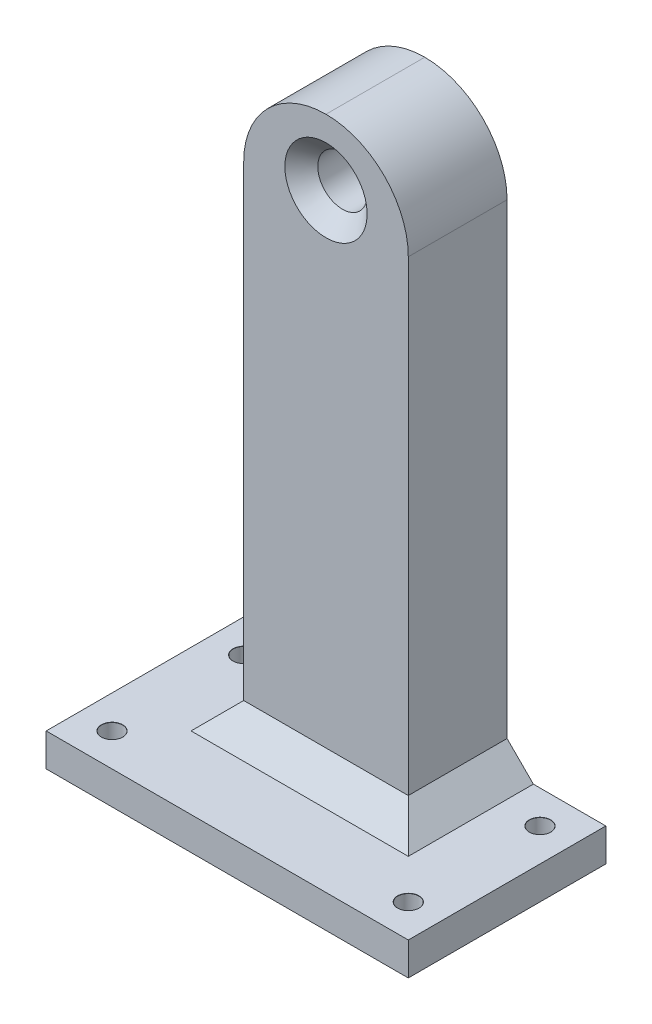
from build123d import *

# Parameters (mm, degrees)
SKETCH1_R                            = 3.75
BOSS_EXTRUDE1_DEPTH                  = 15
SKETCH2_W                            = 55
SKETCH2_H                            = 5
BOSS_EXTRUDE2_DEPTH                  = 30
F_3_2_3_2_DIAMETER_HOLE1_D           = 3.2
F_3_2_3_2_DIAMETER_HOLE1_CSINK_D     = 3.25
F_3_2_3_2_DIAMETER_HOLE1_CSINK_ANGLE = 90
CHAMFER1_SIZE                        = 4
FILLET2_R                            = 12.5
CHAMFER2_SIZE                        = 2.5


with BuildPart() as part:
    # Sketch1 → Boss-Extrude1 (new body)
    with BuildSketch(Plane.XY):
        Polygon((0, 0), (-12.5, 0), (-12.5, 92.37), (12.5, 92.37), (12.5, 0), align=None)
        with Locations((0, 82.37)):
            Circle(SKETCH1_R, mode=Mode.SUBTRACT)
    extrude(amount=BOSS_EXTRUDE1_DEPTH)

    # Sketch2 → Boss-Extrude2 (add)
    with BuildSketch(Plane(origin=(0, 0, 0), x_dir=(-1, 0, 0), z_dir=(0, 0, -1))):
        with Locations((0, 2.5)):
            Rectangle(SKETCH2_W, SKETCH2_H)
    extrude(amount=-BOSS_EXTRUDE2_DEPTH)

    # Ø3.2 (3.2) Diameter Hole1 (through all)
    with Locations(Plane(origin=(0, 5, 0), x_dir=(1, 0, 0), z_dir=(0, 1, 0))):
        with Locations((-22.5, -5), (-22.5, -25), (22.5, -25), (22.5, -5)):
            CounterSinkHole(F_3_2_3_2_DIAMETER_HOLE1_D / 2, F_3_2_3_2_DIAMETER_HOLE1_CSINK_D / 2, counter_sink_angle=F_3_2_3_2_DIAMETER_HOLE1_CSINK_ANGLE)

    # Chamfer1
    chamfer1_edges = [part.edges().sort_by_distance(p)[0] for p in [
        (-12.5, 5, 7.5),
        (0, 5, 15),
        (12.5, 5, 7.5),
    ]]
    chamfer(chamfer1_edges, length=CHAMFER1_SIZE)

    # Fillet2
    fillet2_edges = [part.edges().sort_by_distance(p)[0] for p in [
        (12.5, 92.37, 7.5),
        (-12.5, 92.37, 7.5),
    ]]
    fillet(fillet2_edges, radius=FILLET2_R - 0.0001)  # a hair under: the kernel refuses the full size

    # Chamfer2
    chamfer2_edges = [part.edges().sort_by_distance(p)[0] for p in [
        (-3.75, 82.37, 15),
    ]]
    chamfer(chamfer2_edges, length=CHAMFER2_SIZE)


solid = part.part
